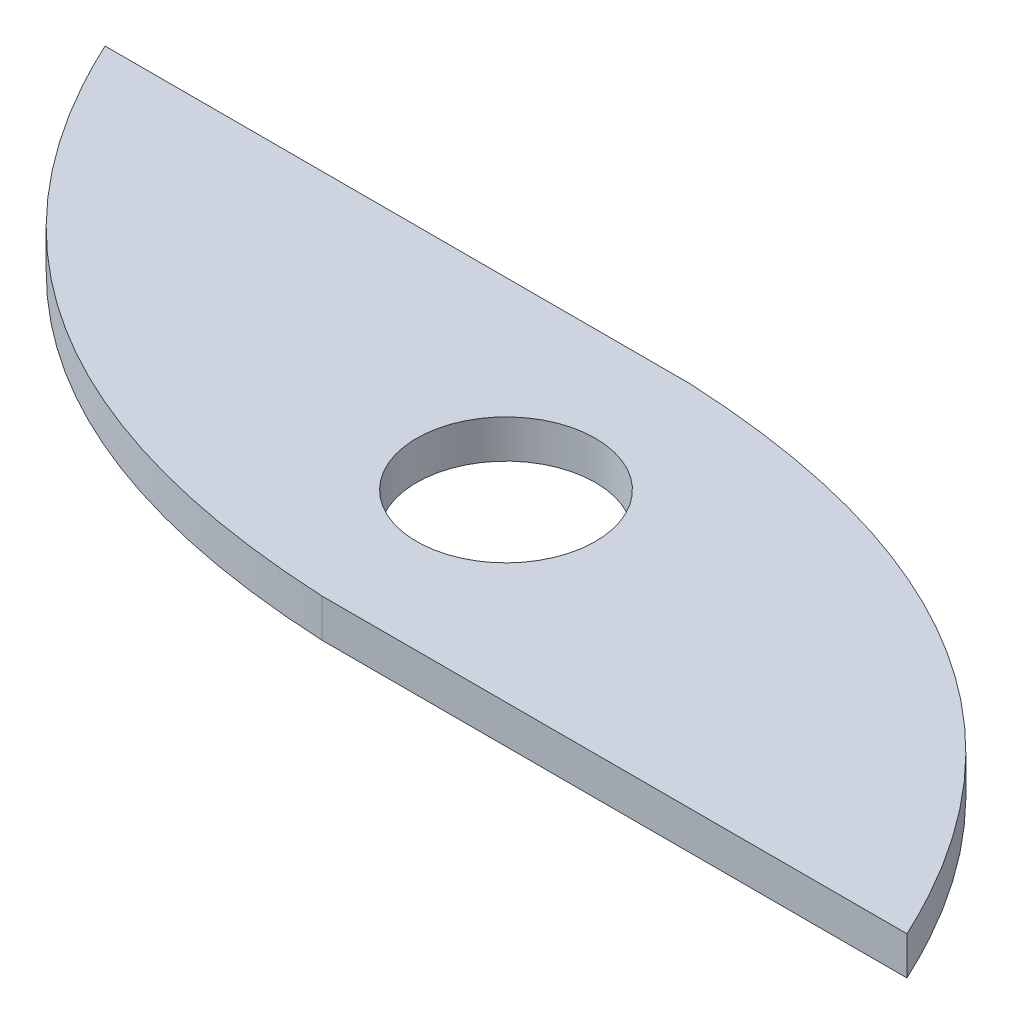
from build123d import *

# Parameters (mm, degrees)
SKETCH1_R           = 11.1125
BOSS_EXTRUDE3_DEPTH = 4.7625


with BuildPart() as part:
    # Sketch1 → Boss-Extrude3 (new body)
    with BuildSketch(Plane(origin=(0, 0, 0), x_dir=(1, 0, 0), z_dir=(0, 1, 0))):
        with BuildLine():
            add(Edge.make_bspline(
                [(-72.690167148, 22.86), (-52.680196885, -20.319089734), (0, -22.86)],
                knots=[0.025517092, 0.025517092, 0.025517092, 1.025517092, 1.025517092, 1.025517092], degree=2))
            Line((0, -22.86), (72.690167148, -22.86))
            add(Edge.make_bspline(
                [(72.690167148, -22.86), (52.680196885, 20.319089734), (0, 22.86)],
                knots=[0.025517092, 0.025517092, 0.025517092, 1.025517092, 1.025517092, 1.025517092], degree=2))
            Line((0, 22.86), (-72.690167148, 22.86))
        make_face()
        Circle(SKETCH1_R, mode=Mode.SUBTRACT)
    extrude(amount=BOSS_EXTRUDE3_DEPTH)


solid = part.part
